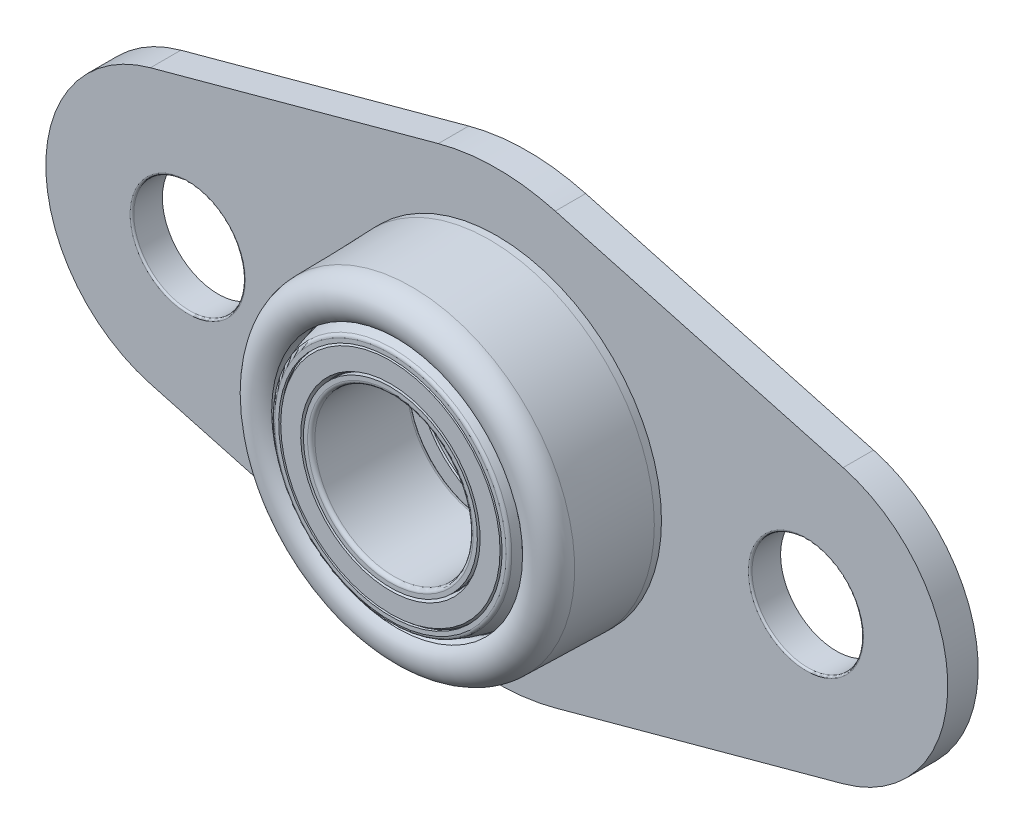
from build123d import *

# Parameters (mm, degrees)
BOSS_EXTRUDE1_START = -3.429
SKETCH4_R           = 2.794
SKETCH4_R_2         = 8.255
BOSS_EXTRUDE1_DEPTH = 1.524
SKETCH5_R           = 0.762381
FILLET1_R           = 0.18288
BOSS_EXTRUDE2_DEPTH = 0.5080254
CIRPATTERN1_COUNT   = 54
FILLET2_R           = 0.508
CHAMFER1_SIZE       = 0.0635
FILLET3_R           = 0.09144
INDENT1_START       = -3.429
INDENT1_DEPTH       = 0.5080254


# Read off the part's stored shape, not the designer's step: Indent1
with BuildPart() as part:
    # Sketch4 → Boss-Extrude1 (new body)
    with BuildSketch(Plane.XY.offset(BOSS_EXTRUDE1_START)):
        with BuildLine():
            Line((-17.359442623, 6.862992629), (-2.931409836, 10.784702702))
            ThreePointArc((-2.931409836, 10.784702702), (0, 11.176), (2.931409836, 10.784702702))
            Line((2.931409836, 10.784702702), (17.359442623, 6.862992629))
            ThreePointArc((17.359442623, 6.862992629), (22.606, 0), (17.359442623, -6.862992629))
            Line((17.359442623, -6.862992629), (2.931409836, -10.784702702))
            ThreePointArc((2.931409836, -10.784702702), (0, -11.176), (-2.931409836, -10.784702702))
            Line((-2.931409836, -10.784702702), (-17.359442623, -6.862992629))
            ThreePointArc((-17.359442623, -6.862992629), (-22.606, 0), (-17.359442623, 6.862992629))
        make_face()
        with Locations(Location((15.494, 0, 0), (0, 0, 180))):
            Circle(SKETCH4_R, mode=Mode.SUBTRACT)
        with Locations(Location((-15.494, 0, 0), (0, 0, 180))):
            Circle(SKETCH4_R, mode=Mode.SUBTRACT)
        with Locations(Location((0, 0, 0), (0, 0, 180))):
            Circle(SKETCH4_R_2, mode=Mode.SUBTRACT)
    extrude(amount=BOSS_EXTRUDE1_DEPTH)

    # Fillet2
    fillet2_edges = [part.edges().sort_by_distance(p)[0] for p in [
        (8.255, 0, -3.429),
    ]]
    fillet(fillet2_edges, radius=FILLET2_R)

    # Fillet3
    fillet3_edges = [part.edges().sort_by_distance(p)[0] for p in [
        (18.288, 0, -1.905),
        (-12.7, 0, -1.905),
    ]]
    fillet(fillet3_edges, radius=FILLET3_R)

    # Indent1 outline → Indent1 (cut)
    with BuildSketch(Plane.XY.offset(INDENT1_START)):
        Polygon((0.518388604, 8.900388604), (0, 8.382), (-0.518388604, 8.900388604), (-0.973090807, 8.325323915), (-1.548155496, 8.780026117), (-1.933022229, 8.156062105), (-2.55698624, 8.540928838), (-2.866812842, 7.876503547), (-3.531238132, 8.186330149), (-3.761834729, 7.490428791), (-4.457736086, 7.721025388), (-4.605984255, 7.003058835), (-5.323950807, 7.151307004), (-5.387845745, 6.420984522), (-6.118168226, 6.48487946), (-6.096845864, 5.752077408), (-6.829647915, 5.730755047), (-6.723396602, 5.005383315), (-7.448768333, 4.899132002), (-7.259024935, 4.191), (-7.967156937, 4.001256602), (-7.696487408, 3.319940598), (-8.377803411, 3.04927107), (-8.029868092, 2.403984696), (-8.675154466, 2.056049378), (-8.254658586, 1.455519025), (-8.855188939, 1.035023145), (-8.367818983, 0.487369955), (-8.915472172, 0), (-8.367818983, -0.487369956), (-8.855188939, -1.035023146), (-8.254658586, -1.455519026), (-8.675154466, -2.056049378), (-8.029868092, -2.403984697), (-8.377803411, -3.04927107), (-7.696487408, -3.319940599), (-7.967156937, -4.001256602), (-7.259024934, -4.191), (-7.448768333, -4.899132003), (-6.723396601, -5.005383316), (-6.829647915, -5.730755047), (-6.096845863, -5.752077409), (-6.118168226, -6.48487946), (-5.387845744, -6.420984523), (-5.323950807, -7.151307004), (-4.605984254, -7.003058836), (-4.457736086, -7.721025388), (-3.761834728, -7.490428791), (-3.531238132, -8.186330149), (-2.866812841, -7.876503548), (-2.55698624, -8.540928838), (-1.933022228, -8.156062105), (-1.548155495, -8.780026117), (-0.973090806, -8.325323915), (-0.518388604, -8.900388604), (0, -8.382), (0.518388604, -8.900388604), (0.973090807, -8.325323915), (1.548155496, -8.780026117), (1.933022229, -8.156062105), (2.55698624, -8.540928838), (2.866812842, -7.876503547), (3.531238132, -8.186330149), (3.761834729, -7.490428791), (4.457736086, -7.721025388), (4.605984255, -7.003058835), (5.323950807, -7.151307004), (5.387845745, -6.420984522), (6.118168226, -6.48487946), (6.096845864, -5.752077408), (6.829647915, -5.730755047), (6.723396602, -5.005383315), (7.448768333, -4.899132002), (7.259024935, -4.191), (7.967156937, -4.001256602), (7.696487408, -3.319940598), (8.377803411, -3.04927107), (8.029868092, -2.403984696), (8.675154466, -2.056049378), (8.254658586, -1.455519025), (8.855188939, -1.035023145), (8.367818983, -0.487369955), (8.915472172, 0), (8.367818983, 0.487369956), (8.855188939, 1.035023146), (8.254658586, 1.455519026), (8.675154466, 2.056049378), (8.029868092, 2.403984697), (8.377803411, 3.04927107), (7.696487408, 3.319940599), (7.967156937, 4.001256602), (7.259024934, 4.191), (7.448768333, 4.899132003), (6.723396601, 5.005383316), (6.829647915, 5.730755047), (6.096845863, 5.752077409), (6.118168226, 6.48487946), (5.387845744, 6.420984523), (5.323950807, 7.151307004), (4.605984254, 7.003058836), (4.457736086, 7.721025388), (3.761834728, 7.490428791), (3.531238132, 8.186330149), (2.866812841, 7.876503548), (2.55698624, 8.540928838), (1.933022228, 8.156062105), (1.548155495, 8.780026117), (0.973090806, 8.325323915), align=None)
    extrude(amount=INDENT1_DEPTH, mode=Mode.SUBTRACT)


with BuildPart() as body_2:
    # Sketch5 → Revolve1 (revolve)
    with BuildSketch(Plane(origin=(0, 0, 0), x_dir=(0, 0, -1), z_dir=(1, 0, 0)), mode=Mode.PRIVATE) as revolve1_sk:
        with Locations((-2.3368, 7.077798261)):
            Circle(SKETCH5_R)
        with BuildLine():
            Line((3.429, 8.255), (1.54686, 8.255))
            Line((1.54686, 8.255), (-2.360626217, 8.169738347))
            ThreePointArc((-2.360626217, 8.169738347), (-3.354738995, 7.473653087), (-3.09207056, 6.288832342))
            Line((-3.09207056, 6.288832342), (-2.881560847, 6.508733657))
            ThreePointArc((-2.881560847, 6.508733657), (-2.823159589, 7.697518565), (-1.654561641, 7.471688761))
            Line((-1.654561641, 7.471688761), (-1.067037737, 6.454067508))
            Line((-1.067037737, 6.454067508), (1.5964, 6.454067508))
            Line((1.5964, 6.454067508), (1.5964, 6.5405))
            Line((1.5964, 6.5405), (2.4129492, 6.5405))
            Line((2.4129492, 6.5405), (2.4129492, 4.445))
            Line((2.4129492, 4.445), (3.429, 4.445))
            Line((3.429, 4.445), (3.429, 8.255))
        make_face()
        with BuildLine():
            Line((-3.429, 3.96875), (1.571, 3.96875))
            Line((1.571, 3.96875), (1.571, 5.800070388))
            ThreePointArc((1.571, 5.800070388), (1.539534769, 5.902630916), (1.455966513, 5.969899552))
            ThreePointArc((1.455966513, 5.969899552), (-0.929, 6.428667508), (-3.313966513, 5.969899552))
            ThreePointArc((-3.313966513, 5.969899552), (-3.397534769, 5.902630916), (-3.429, 5.800070388))
            Line((-3.429, 5.800070388), (-3.429, 3.96875))
        make_face()
    revolve(revolve1_sk.sketch.rotate(Axis((0, 0, -3.429), (0, 0, 1)), 90), axis=Axis((0, 0, -3.429), (0, 0, 1)))

    # Fillet1
    fillet1_edges = [body_2.edges().sort_by_distance(p)[0] for p in [
        (3.96875, 0, 3.429),
        (3.96875, 0, -1.571),
    ]]
    fillet(fillet1_edges, radius=FILLET1_R)

    # Sketch6 → Boss-Extrude2 (add)
    with BuildSketch(Plane(origin=(0, 0, -3.429), x_dir=(-1, 0, 0), z_dir=(0, 0, -1))):
        with BuildLine():
            Line((0.518388604, 8.900388604), (0.973090807, 8.325323915))
            Line((0.973090807, 8.325323915), (0.516033004, 4.4149445))
            ThreePointArc((0.516033004, 4.4149445), (0.258453765, 4.437479764), (0, 4.445))
            Line((0, 4.445), (0, 8.382))
            Line((0, 8.382), (0.518388604, 8.900388604))
        make_face()
    boss_extrude2 = extrude(amount=-BOSS_EXTRUDE2_DEPTH)

    # CirPattern1: Boss-Extrude2 ×54 about axis
    cirpattern1_axis = Axis((0, 0, 0), (0, 0, 1))
    for i in range(1, CIRPATTERN1_COUNT):
        add(boss_extrude2.rotate(cirpattern1_axis, i * 360 / CIRPATTERN1_COUNT))

    # Chamfer1
    chamfer1_edges = [body_2.edges().sort_by_distance(p)[0] for p in [
        (-4.443119543, 0.129281575, -3.429),
        (4.445, 0, -2.4129492),
    ]]
    chamfer(chamfer1_edges, length=CHAMFER1_SIZE)

    # Sketch7 → Cut-Revolve1 (revolve, cut)
    with BuildSketch(Plane(origin=(0, 0, 0), x_dir=(0, 0, -1), z_dir=(1, 0, 0))):
        Polygon((-3.429, 5.497347098), (-3.12198901, 5.674599976), (1.26398901, 5.674599976), (1.571, 5.497347098), (1.571, 5.599999976), (1.444, 5.599999976), (1.270794919, 5.699999976), (-3.128794919, 5.699999976), (-3.302, 5.599999976), (-3.429, 5.599999976), align=None)
        Polygon((-3.429, 4.497347098), (-3.12198901, 4.385604236), (-3.12198901, 4.334804236), (1.26398901, 4.334804236), (1.26398901, 4.385604236), (1.571, 4.497347098), (1.571, 4.360204236), (1.28938901, 4.360204236), (1.28938901, 4.309404236), (-3.14738901, 4.309404236), (-3.14738901, 4.360204236), (-3.429, 4.360204236), align=None)
    revolve(axis=Axis((0, 0, 0), (0, 0, 1)), mode=Mode.SUBTRACT)


solid = Compound([part.part, body_2.part])
